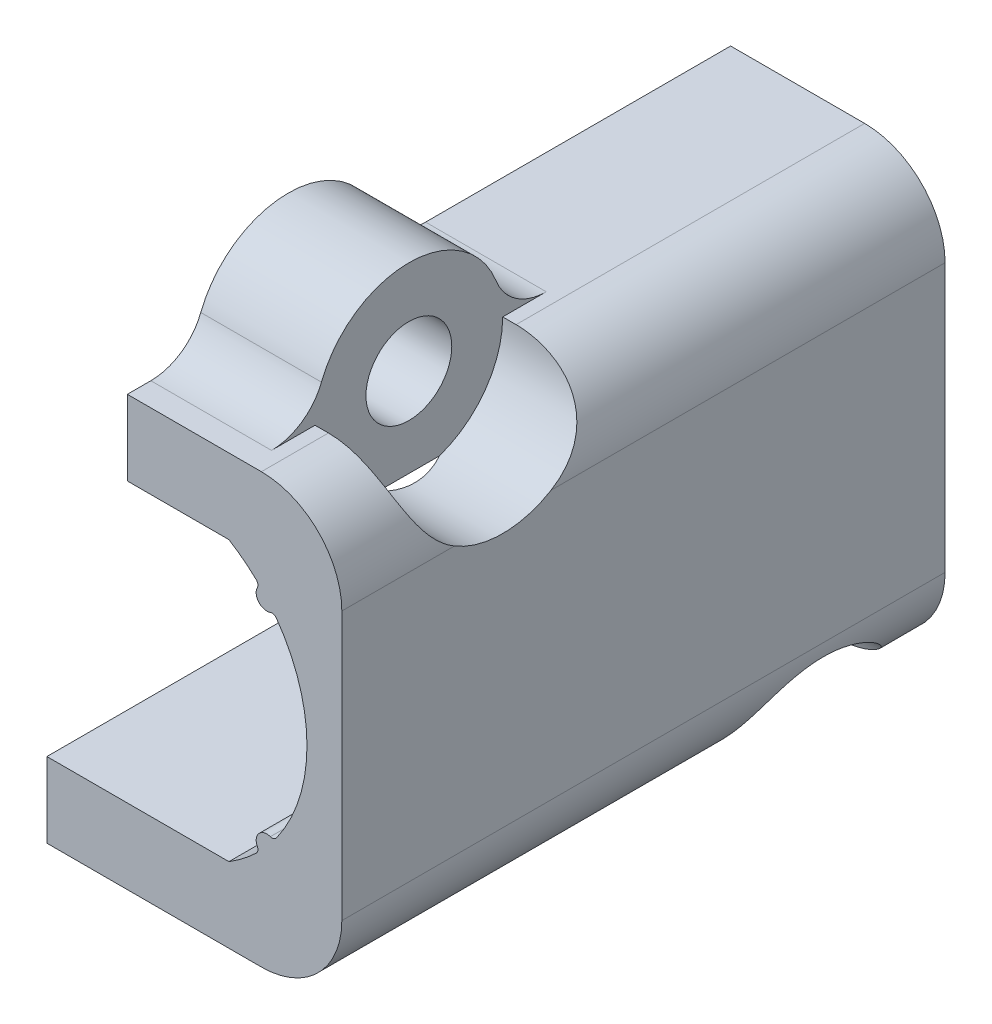
from build123d import *
from build123d.topology import SkipClean

# Parameters (mm, degrees)
SKETCH_1_W          = 8
SKETCH_1_H          = 20
EXTRUDE_1_DEPTH     = 16
CUT_EXTRUDE_1_REACH = 28.833
SKETCH_2_W          = 6.8
SKETCH_2_H          = 10.4
EXTRUDE_3_DEPTH     = 10.8
CUT_EXTRUDE_2_REACH = 28.833
SKETCH_4_R          = 1.6
EXTRUDE_5_DEPTH     = 3
EXTRUDE_START       = -4.5
SKETCH_5_R          = 1.6
EXTRUDE_4_DEPTH     = 4.5
EXTRUDE_START_2     = -3
SKETCH_7_R          = 3.5
SKETCH_7_R_2        = 1.6
EXTRUDE_6_DEPTH     = 3
CUT_EXTRUDE_3_REACH = 31.056
SKETCH_8_R          = 3.5
EXTRUDE_7_DEPTH     = 0.5
CUT_EXTRUDE_4_REACH = 31.27
SKETCH_10_R         = 3.5
EXTRUDE_START_3     = 2
EXTRUDE_8_DEPTH     = 2
FILLET_1_R          = 2
FILLET_2_R          = 3
SKETCH_12_W         = 9.7
SKETCH_12_H         = 10.4
EXTRUDE_9_DEPTH     = 0.6
SKETCH_13_R         = 0.4
EXTRUDE_10_DEPTH    = 12.8
FILLET_3_R          = 0.2
EXTRUDE_11_REACH    = 32.356
SKETCH_14_R         = 0.3
SKETCH_15_R         = 0.3
CUT_EXTRUDE_5_DEPTH = 3
FILLET_4_R          = 0.2


with BuildPart() as part:
    # 草图1 → 凸台-拉伸1 (new body)
    with BuildSketch(Plane(origin=(0, 0, 0), x_dir=(1, 0, 0), z_dir=(0, 1, 0))):
        with Locations((4, 10)):
            Rectangle(SKETCH_1_W, SKETCH_1_H)
    extrude(amount=EXTRUDE_1_DEPTH)

    # 草图2 → 切除-拉伸1 (cut, up to next)
    with BuildSketch(Plane.XY, mode=Mode.PRIVATE) as cut_extrude_1_sk1:
        with Locations((3.4, 8)):
            Rectangle(SKETCH_2_W, SKETCH_2_H)
    cut_extrude_1_tool1 = extrude(cut_extrude_1_sk1.sketch, amount=-CUT_EXTRUDE_1_REACH, mode=Mode.PRIVATE) & part.part
    add(cut_extrude_1_tool1.solids().sort_by_distance((3.4, 8, 0))[0], mode=Mode.SUBTRACT)

    # 草图3 → 凸台-拉伸3 (add)
    with BuildSketch(Plane.XY):
        with BuildLine():
            Line((3.789043744, 13.2), (6.8, 13.2))
            Line((6.8, 13.2), (6.8, 2.8))
            Line((6.8, 2.8), (3.789043744, 2.8))
            ThreePointArc((3.789043744, 2.8), (6.7, 8), (3.789043744, 13.2))
        make_face()
    extrude(amount=-EXTRUDE_3_DEPTH)

    # 草图4 → 切除-拉伸2 (cut, up to next)
    with BuildSketch(Plane(origin=(8, 0, 0), x_dir=(0, 0, -1), z_dir=(1, 0, 0)), mode=Mode.PRIVATE) as cut_extrude_2_sk1:
        with Locations((4, 16)):
            Circle(SKETCH_4_R)
    cut_extrude_2_tool1 = extrude(cut_extrude_2_sk1.sketch, amount=-CUT_EXTRUDE_2_REACH, mode=Mode.PRIVATE) & part.part
    # 草图4 → 切除-拉伸2 (cut, up to next)
    with BuildSketch(Plane(origin=(8, 0, 0), x_dir=(0, 0, -1), z_dir=(1, 0, 0)), mode=Mode.PRIVATE) as cut_extrude_2_sk2:
        with Locations((16, -1)):
            Circle(SKETCH_4_R)
    cut_extrude_2_tool2 = extrude(cut_extrude_2_sk2.sketch, amount=-CUT_EXTRUDE_2_REACH, mode=Mode.PRIVATE) & part.part
    add(cut_extrude_2_tool1.solids().sort_by_distance((8, 16, -4))[0], mode=Mode.SUBTRACT)
    add(cut_extrude_2_tool2.solids().sort_by_distance((8, -1, -16))[0], mode=Mode.SUBTRACT)

    # 草图6 → 凸台-拉伸5 (add)
    with BuildSketch(Plane.ZY):
        with BuildLine():
            Line((-20, 0), (-17.2489996, 0))
            ThreePointArc((-17.2489996, 0), (-16, 0.6), (-14.7510004, 0))
            Line((-14.7510004, 0), (0, 0))
            Line((0, 0), (0, 2.8))
            Line((0, 2.8), (-20, 2.8))
            Line((-20, 2.8), (-20, 0))
        make_face()
    extrude(amount=EXTRUDE_5_DEPTH)

    # 草图5 → 凸台-拉伸4 (add)
    with BuildSketch(Plane.ZY.offset(EXTRUDE_START)):
        with BuildLine():
            Line((-6.1, 13.2), (-1.9, 13.2))
            ThreePointArc((-1.9, 13.2), (-4, 19.5), (-6.1, 13.2))
        make_face()
        with Locations(Location((-4, 16, 0), (0, 0, 180))):
            Circle(SKETCH_5_R, mode=Mode.SUBTRACT)
    extrude(amount=EXTRUDE_4_DEPTH)

    # 草图7 → 凸台-拉伸6 (add)
    with BuildSketch(Plane.ZY.offset(3).offset(EXTRUDE_START_2)):
        with Locations((-16, -1)):
            Circle(SKETCH_7_R)
        with Locations(Location((-16, -1, 0), (0, 0, 141.317812547))):
            Circle(SKETCH_7_R_2, mode=Mode.SUBTRACT)
    extrude(amount=EXTRUDE_6_DEPTH)

    # 草图8 → 切除-拉伸3 (cut, up to next)
    with BuildSketch(Plane(origin=(0, 0, 0), x_dir=(0, 0, -1), z_dir=(1, 0, 0)), mode=Mode.PRIVATE) as cut_extrude_3_sk1:
        with Locations((16, -1)):
            Circle(SKETCH_8_R)
    cut_extrude_3_tool1 = extrude(cut_extrude_3_sk1.sketch, amount=CUT_EXTRUDE_3_REACH, mode=Mode.PRIVATE) & part.part
    add(cut_extrude_3_tool1.solids().sort_by_distance((0, -1, -16))[0], mode=Mode.SUBTRACT)

    # 草图9 → 凸台-拉伸7 (add)
    with SkipClean():  # the faces are left unmerged after this step: merging them gives an invalid solid
        with BuildSketch(Plane(origin=(0, 0, -20), x_dir=(-1, 0, 0), z_dir=(0, 0, -1))):
            Polygon((-6.8, 2.8), (-6.8, 13.2), (0, 13.2), (0, 16), (-8, 16), (-8, 0), (3, 0), (3, 2.8), align=None)
        extrude(amount=EXTRUDE_7_DEPTH)

    # 草图10 → 切除-拉伸4 (cut, up to next)
    with BuildSketch(Plane(origin=(4.5, 0, 0), x_dir=(0, 0, -1), z_dir=(1, 0, 0)), mode=Mode.PRIVATE) as cut_extrude_4_sk1:
        with Locations((4, 16)):
            Circle(SKETCH_10_R)
    cut_extrude_4_tool1 = extrude(cut_extrude_4_sk1.sketch, amount=CUT_EXTRUDE_4_REACH, mode=Mode.PRIVATE) & part.part
    add(cut_extrude_4_tool1.solids().sort_by_distance((4.5, 16, -4))[0], mode=Mode.SUBTRACT)

    # 草图11 → 凸台-拉伸8 (add)
    with SkipClean():  # the faces are left unmerged after this step: merging them gives an invalid solid
        with BuildSketch(Plane.XY.offset(EXTRUDE_START_3)):
            with BuildLine():
                Line((0, 13.2), (3.789043744, 13.2))
                ThreePointArc((3.789043744, 13.2), (6.7, 8), (3.789043744, 2.8))
                Line((3.789043744, 2.8), (-3, 2.8))
                Line((-3, 2.8), (-3, 0))
                Line((-3, 0), (8, 0))
                Line((8, 0), (8, 16))
                Line((8, 16), (0, 16))
                Line((0, 16), (0, 13.2))
            make_face()
        extrude(amount=-EXTRUDE_8_DEPTH)

    # 圆角1
    # the kernel refuses this fillet: 2 mm, written as the material it adds along each edge
    with BuildSketch(Plane(origin=(-3, 0, -19.354101966), x_dir=(0, 0, -1), z_dir=(1, 0, 0))) as fillet_1_piece_1:
        with BuildLine():
            CenterArc((2.09291543, -1.761578284), FILLET_1_R, 118.262295856, 53.77845338)
            ThreePointArc((0.112181831, -1.484640726), (0.135948895, -0.736286166), (0, 0))
            Line((0, 0), (1.145898034, 0))
        make_face()
    extrude(amount=3)
    with BuildSketch(Plane(origin=(-3, 0, -12.645898034), x_dir=(0, 0, 1), z_dir=(1, 0, 0))) as fillet_1_piece_2:
        with BuildLine():
            CenterArc((2.054224947, 2), FILLET_1_R, 190.475681696, 79.524318304)
            ThreePointArc((0.087560615, 1.636363636), (0.140898096, 0.812985117), (0, 0))
            Line((0, 0), (2.054224947, 0))
        make_face()
    extrude(amount=3)
    with BuildSketch(Plane(origin=(0, 16, -7.5), x_dir=(0, 0, -1), z_dir=(1, 0, 0))) as fillet_1_piece_3:
        with BuildLine():
            CenterArc((1.623475383, 2), FILLET_1_R, 201.323686263, 68.676313737)
            ThreePointArc((-0.239606574, 1.272727273), (-0.06042321, 0.647542667), (0, 0))
            Line((0, 0), (1.623475383, 0))
        make_face()
    extrude(amount=4.5)
    with BuildSketch(Plane(origin=(0, 16, -0.5), x_dir=(0, 0, 1), z_dir=(1, 0, 0))) as fillet_1_piece_4:
        with BuildLine():
            CenterArc((1.623475383, -2), FILLET_1_R, 90, 68.676313737)
            ThreePointArc((-0.239606574, -1.272727273), (-0.06042321, -0.647542667), (0, 0))
            Line((0, 0), (1.623475383, 0))
        make_face()
    extrude(amount=4.5)

    # 圆角2
    # the kernel refuses this fillet: 3 mm, written as the material it takes off along each edge
    with BuildSketch(Plane(origin=(8, 16, -8), x_dir=(-1, 0, 0), z_dir=(0, 0, 1))) as fillet_2_piece_1:
        with BuildLine():
            CenterArc((FILLET_2_R, FILLET_2_R), FILLET_2_R, 180, 90)
            Line((0, FILLET_2_R), (0, 0))
            Line((0, 0), (FILLET_2_R, 0))
        make_face()
    extrude(amount=17.5, mode=Mode.SUBTRACT)
    with BuildSketch(Plane(origin=(8, 0, -11.854101966), x_dir=(0, 1, 0), z_dir=(0, 0, -1))) as fillet_2_piece_2:
        with BuildLine():
            CenterArc((FILLET_2_R, -FILLET_2_R), FILLET_2_R, 90, 90)
            Line((0, -FILLET_2_R), (0, 0))
            Line((0, 0), (FILLET_2_R, 0))
        make_face()
    extrude(amount=16.145898034, mode=Mode.SUBTRACT)
    with BuildSketch(Plane(origin=(8, 16, -28), x_dir=(0, -1, 0), z_dir=(0, 0, 1))) as fillet_2_piece_3:
        with BuildLine():
            CenterArc((FILLET_2_R, -FILLET_2_R), FILLET_2_R, 90, 90)
            Line((0, -FILLET_2_R), (0, 0))
            Line((0, 0), (FILLET_2_R, 0))
        make_face()
    extrude(amount=28, mode=Mode.SUBTRACT)
    with BuildSketch(Plane(origin=(8, 0, -20.145898034), x_dir=(0, 1, 0), z_dir=(0, 0, 1))) as fillet_2_piece_4:
        with BuildLine():
            CenterArc((FILLET_2_R, FILLET_2_R), FILLET_2_R, 180, 90)
            Line((0, FILLET_2_R), (0, 0))
            Line((0, 0), (FILLET_2_R, 0))
        make_face()
    extrude(amount=29.645898034, mode=Mode.SUBTRACT)

    # 草图12 → 凸台-拉伸9 (add)
    with BuildSketch(Plane.ZY.offset(-6.8)):
        with Locations((-15.65, 8)):
            Rectangle(SKETCH_12_W, SKETCH_12_H)
    extrude(amount=EXTRUDE_9_DEPTH)

    # 草图13 → 凸台-拉伸10 (add)
    with BuildSketch(Plane.XY.offset(2)):
        with Locations((5.205431576, 12)):
            Circle(SKETCH_13_R)
        with Locations((5.205431576, 4)):
            Circle(SKETCH_13_R)
    extrude(amount=-EXTRUDE_10_DEPTH)

    # 圆角3
    fillet_3_edges = [part.edges().sort_by_distance(p)[0] for p in [
        (4.933376021, 12.293233311, -5.4),
        (5.457684147, 11.689567011, -5.4),
        (5.457684147, 4.310432989, -5.4),
        (4.933376021, 3.706766689, -5.4),
    ]]
    fillet(fillet_3_edges, radius=FILLET_3_R)

    # 凸台-拉伸11: up to this face of the body (flat: up to its plane)
    extrude_11_end = Plane(part.part.faces().sort_by_distance((6.2, 8, -15.65))[0])
    # 草图14 → 凸台-拉伸11 (add, up to the picked face)
    with BuildSketch(Plane.ZY.offset(3), mode=Mode.PRIVATE) as extrude_11_sk1:
        with Locations((-15.65, 13.2)):
            Circle(SKETCH_14_R)
    extrude_11_tool1 = split(extrude(extrude_11_sk1.sketch, amount=-EXTRUDE_11_REACH, mode=Mode.PRIVATE), bisect_by=extrude_11_end, keep=Keep.BOTH, mode=Mode.PRIVATE)
    # 草图14 → 凸台-拉伸11 (add, up to the picked face)
    with BuildSketch(Plane.ZY.offset(3), mode=Mode.PRIVATE) as extrude_11_sk2:
        with Locations((-15.65, 2.8)):
            Circle(SKETCH_14_R)
    extrude_11_tool2 = split(extrude(extrude_11_sk2.sketch, amount=-EXTRUDE_11_REACH, mode=Mode.PRIVATE), bisect_by=extrude_11_end, keep=Keep.BOTH, mode=Mode.PRIVATE)
    add(extrude_11_tool1.solids().sort_by(Axis((-3, 13.2, -15.65), (1, 0, 0)))[0])
    add(extrude_11_tool2.solids().sort_by(Axis((-3, 2.8, -15.65), (1, 0, 0)))[0])

    # 草图15 → 切除-拉伸5 (cut)
    with BuildSketch(Plane.ZY.offset(3)):
        with Locations((-15.65, 13.2)):
            Circle(SKETCH_15_R)
    extrude(amount=-CUT_EXTRUDE_5_DEPTH, mode=Mode.SUBTRACT)

    # 圆角4
    # the kernel refuses this fillet: 0.2 mm, written as the material it adds along each edge
    with BuildSketch(Plane(origin=(6.595643924, 13.2, -15.95), x_dir=(0, -0.978906312930706, 0.20430964368920726), z_dir=(-1, 0, 0))) as fillet_4_piece_1:
        with BuildLine():
            CenterArc((0.163447715, -0.195781263), FILLET_4_R, 101.789089239, 66.421821522)
            Line((-0.032333548, -0.154919334), (0, 0))
            ThreePointArc((0, 0), (0.061292893, -0.006328106), (0.122585786, 0))
        make_face()
    extrude(amount=6.595643924)
    with BuildSketch(Plane(origin=(0, 13.2, -15.35), x_dir=(0, 0, 1), z_dir=(1, 0, 0))) as fillet_4_piece_2:
        with BuildLine():
            CenterArc((0.158257569, 0.2), FILLET_4_R, 203.578178478, 66.421821522)
            ThreePointArc((-0.025045458, 0.12), (-0.006328106, 0.061292893), (0, 0))
            Line((0, 0), (0.158257569, 0))
        make_face()
    extrude(amount=6.595643924)
    with BuildSketch(Plane(origin=(-3, 2.8, -15.35), x_dir=(0, 0, 1), z_dir=(1, 0, 0))) as fillet_4_piece_3:
        with BuildLine():
            CenterArc((0.158257569, -0.2), FILLET_4_R, 90, 66.421821522)
            ThreePointArc((-0.025045458, -0.12), (-0.006328106, -0.061292893), (0, 0))
            Line((0, 0), (0.158257569, 0))
        make_face()
    extrude(amount=9.595643924)
    with BuildSketch(Plane(origin=(6.595643924, 2.8, -15.95), x_dir=(0, 0.9789063129307064, 0.20430964368920507), z_dir=(-1, 0, 0))) as fillet_4_piece_4:
        with BuildLine():
            CenterArc((0.163447715, 0.195781263), FILLET_4_R, 191.789089239, 66.421821522)
            Line((-0.032333548, 0.154919334), (0, 0))
            ThreePointArc((0, 0), (0.061292893, 0.006328106), (0.122585786, 0))
        make_face()
    extrude(amount=9.595643924)


solid = part.part
